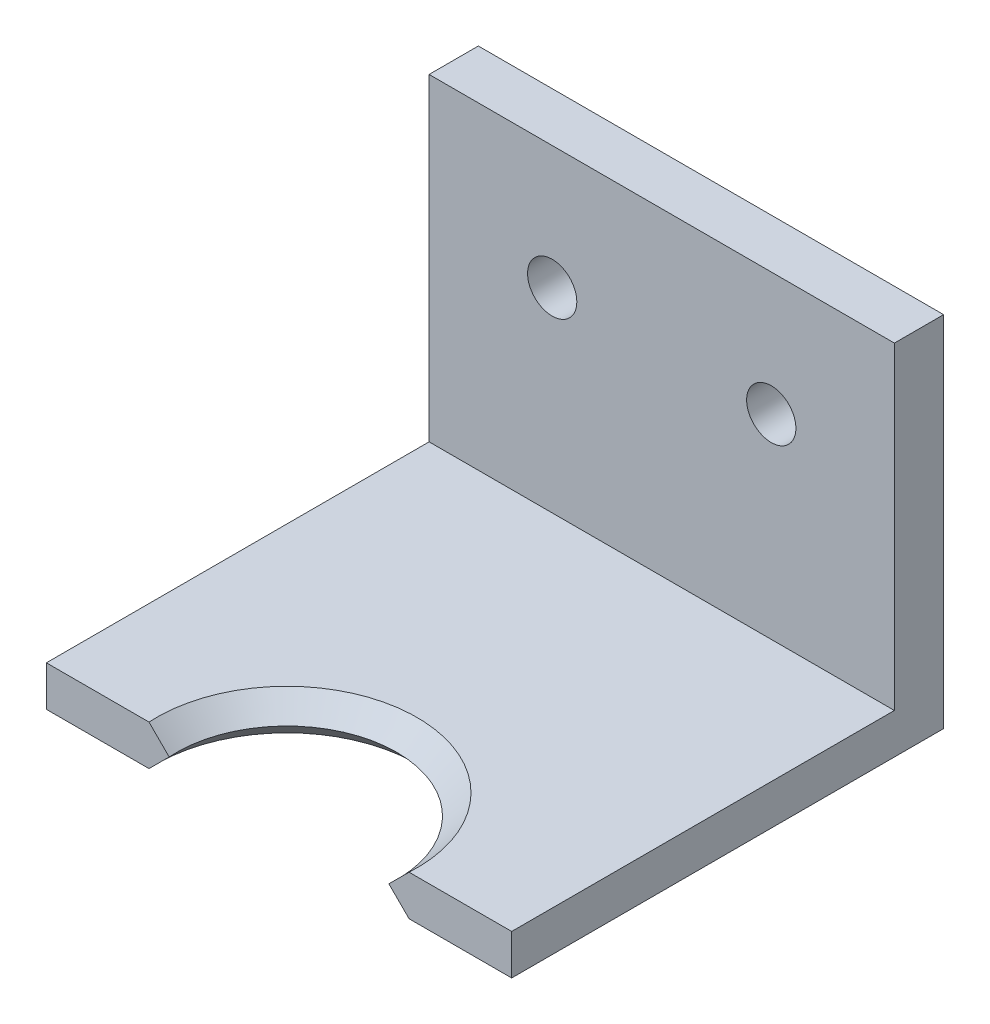
from build123d import *

# Parameters (mm, degrees)
PROFILE_BOSS_EXTRUDE1_DEPTH      = 30
COLLARCUT_EXTRUDE1_DEPTH         = 46.78748337
COLLAR_CHAMFER2_SIZE             = 1.3
MOUNTINGHOLES_SKETCH3_R          = 1.5875
MOUNTINGHOLES_CUT_EXTRUDE2_DEPTH = 44.928655321


with BuildPart() as part:
    # Profile-Sketch1 → Profile-Boss-Extrude1 (new body)
    with BuildSketch(Plane(origin=(0, 0, 0), x_dir=(0, 0, -1), z_dir=(1, 0, 0))):
        Polygon((0, 0), (24.675, 0), (24.675, 20.515144), (27.85, 20.515144), (27.85, -2.6), (0, -2.6), align=None)
    extrude(amount=PROFILE_BOSS_EXTRUDE1_DEPTH)

    # CollarSketch2 → CollarCut-Extrude1 (cut, through all)
    with BuildSketch(Plane(origin=(0, 0, 0), x_dir=(1, 0, 0), z_dir=(0, 1, 0))):
        with BuildLine():
            Line((7.917627516, 0), (22.082372484, 0))
            ThreePointArc((22.082372484, 0), (15, 7.6), (7.917627516, 0))
        make_face()
    extrude(amount=-COLLARCUT_EXTRUDE1_DEPTH, mode=Mode.SUBTRACT)

    # Collar-Chamfer2
    collar_chamfer2_edges = [part.edges().sort_by_distance(p)[0] for p in [
        (15, -2.6, -7.6),
        (15, 0, -7.6),
    ]]
    chamfer(collar_chamfer2_edges, length=COLLAR_CHAMFER2_SIZE - 0.0001)  # a hair under: the kernel refuses the full size

    # MountingHoles-Sketch3 → MountingHoles-Cut-Extrude2 (cut, through all)
    with BuildSketch(Plane.XY.offset(-24.675)):
        with Locations((7.9375, 12.577644)):
            Circle(MOUNTINGHOLES_SKETCH3_R)
        with Locations((22.0625, 12.577644)):
            Circle(MOUNTINGHOLES_SKETCH3_R)
    extrude(amount=-MOUNTINGHOLES_CUT_EXTRUDE2_DEPTH, mode=Mode.SUBTRACT)


solid = part.part
